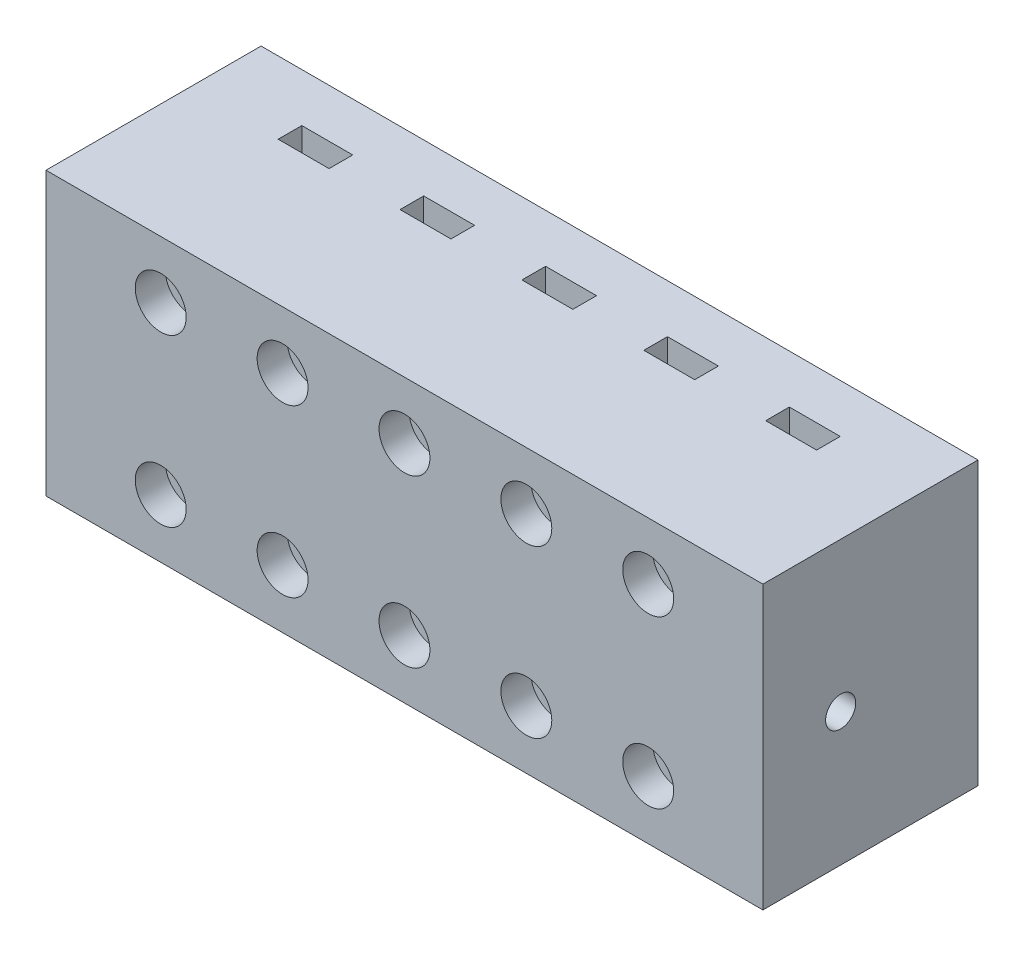
from build123d import *

# Parameters (mm, degrees)
SKIZZE2_W                            = 100
SKIZZE2_H                            = 39.364160046
AUFSATZ_LINEAR_AUSTRAGEN1_DEPTH      = 30
SCHNITT_LINEAR_AUSTRAGEN1_DEPTH      = 40
SCHNITT_LINEAR_AUSTRAGEN1_DEPTH_BACK = 40
SKIZZE10_R                           = 5
SKIZZE17_R                           = 1.55
SCHNITT_LINEAR_AUSTRAGEN2_DEPTH      = 9.1
SKIZZE24_R                           = 2.05
SCHNITT_LINEAR_AUSTRAGEN4_DEPTH      = 112.577493681
SKIZZE41_R                           = 3.55
SCHNITT_LINEAR_AUSTRAGEN11_DEPTH     = 4.2
LINEARES_MUSTER5_COUNT               = 5
LINEARES_MUSTER5_PITCH               = 17
SPIEGELN9_COPY_1_SKETCH_R            = 3.55
SPIEGELN9_COPY_1_DEPTH               = 4.2
SPIEGELN9_COPY_2_SKETCH_R            = 3.55
SPIEGELN9_COPY_2_DEPTH               = 4.2
SPIEGELN9_COPY_3_SKETCH_R            = 3.55
SPIEGELN9_COPY_3_DEPTH               = 4.2
SPIEGELN9_COPY_4_SKETCH_R            = 3.55
SPIEGELN9_COPY_4_DEPTH               = 4.2
SPIEGELN9_COPY_5_SKETCH_R            = 3.55
SPIEGELN9_COPY_5_DEPTH               = 4.2
SKIZZE28_W                           = 7.1
SKIZZE28_H                           = 3.3
SCHNITT_LINEAR_AUSTRAGEN5_DEPTH      = 7.96
SCHNITT_LINEAR_START                 = -4.2
SCHNITT_LINEAR_AUSTRAGEN8_DEPTH      = 5.85
LINEARES_MUSTER3_COUNT               = 5
LINEARES_MUSTER3_PITCH               = 17
LINEARES_MUSTER4_COUNT               = 5
LINEARES_MUSTER4_PITCH               = 17
SPIEGELN7_START                      = -4.2
SPIEGELN7_COPY_1_DEPTH               = 5.85
SPIEGELN7_COPY_2_DEPTH               = 5.85
SPIEGELN7_COPY_3_DEPTH               = 5.85
SPIEGELN7_COPY_4_DEPTH               = 5.85
SPIEGELN7_COPY_5_DEPTH               = 5.85
SPIEGELN8_COPY_1_SKETCH_W            = 7.1
SPIEGELN8_COPY_1_SKETCH_H            = 3.3
SPIEGELN8_COPY_1_DEPTH               = 7.96
SPIEGELN8_COPY_2_SKETCH_W            = 7.1
SPIEGELN8_COPY_2_SKETCH_H            = 3.3
SPIEGELN8_COPY_2_DEPTH               = 7.96
SPIEGELN8_COPY_3_SKETCH_W            = 7.1
SPIEGELN8_COPY_3_SKETCH_H            = 3.3
SPIEGELN8_COPY_3_DEPTH               = 7.96
SPIEGELN8_COPY_4_SKETCH_W            = 7.1
SPIEGELN8_COPY_4_SKETCH_H            = 3.3
SPIEGELN8_COPY_4_DEPTH               = 7.96
SPIEGELN8_COPY_5_SKETCH_W            = 7.1
SPIEGELN8_COPY_5_SKETCH_H            = 3.3
SPIEGELN8_COPY_5_DEPTH               = 7.96
SKIZZE37_R                           = 0.5
SCHNITT_LINEAR_AUSTRAGEN9_DEPTH      = 112.577493681
SKIZZE40_R                           = 2.1
SCHNITT_LINEAR_AUSTRAGEN10_DEPTH     = 6


with BuildPart() as part:
    # Skizze2 → Aufsatz-Linear austragen1 (new body)
    with BuildSketch(Plane.XY):
        with Locations((50, 19.682080023)):
            Rectangle(SKIZZE2_W, SKIZZE2_H)
    extrude(amount=AUFSATZ_LINEAR_AUSTRAGEN1_DEPTH)

    # Skizze10 → Schnitt-Linear austragen1 (cut, two sides: drawn at the far end of the back side and taken through both)
    with BuildSketch(Plane.ZY.offset(-50).offset(-SCHNITT_LINEAR_AUSTRAGEN1_DEPTH_BACK)):
        with Locations((14.945770016, 20.027045739)):
            Circle(SKIZZE10_R)
    extrude(amount=SCHNITT_LINEAR_AUSTRAGEN1_DEPTH + SCHNITT_LINEAR_AUSTRAGEN1_DEPTH_BACK, mode=Mode.SUBTRACT)

    # Skizze17 → Schnitt-Linear austragen2 (cut)
    with BuildSketch(Plane.ZY.offset(-90)):
        with Locations((14.945770016, 20.027045739)):
            Circle(SKIZZE17_R)
    schnitt_linear_austragen2 = extrude(amount=-SCHNITT_LINEAR_AUSTRAGEN2_DEPTH, mode=Mode.SUBTRACT)

    # Spiegeln1: Schnitt-Linear austragen2 across plane
    add(schnitt_linear_austragen2.mirror(Plane.ZY.offset(-50)), mode=Mode.SUBTRACT)

    # Skizze24 → Schnitt-Linear austragen4 (cut, through all)
    with BuildSketch(Plane.XY.offset(30)):
        with Locations((16, 31.364160046)):
            Circle(SKIZZE24_R)
        with Locations((33, 31.364160046)):
            Circle(SKIZZE24_R)
        with Locations((50, 31.364160046)):
            Circle(SKIZZE24_R)
        with Locations((67, 31.364160046)):
            Circle(SKIZZE24_R)
        with Locations((84, 31.364160046)):
            Circle(SKIZZE24_R)
    schnitt_linear_austragen4 = extrude(amount=-SCHNITT_LINEAR_AUSTRAGEN4_DEPTH, mode=Mode.SUBTRACT)

    # Spiegeln4: Schnitt-Linear austragen4 across plane
    add(schnitt_linear_austragen4.mirror(Plane.ZX.offset(19.764160046)), mode=Mode.SUBTRACT)

    # Skizze41 → Schnitt-Linear austragen11 (cut)
    with BuildSketch(Plane.XY.offset(30)):
        with Locations((16, 31.364160046)):
            Circle(SKIZZE41_R)
    schnitt_linear_austragen11 = extrude(amount=-SCHNITT_LINEAR_AUSTRAGEN11_DEPTH, mode=Mode.SUBTRACT)

    # Lineares Muster5: Schnitt-Linear austragen11 ×5
    with Locations(*[(i * LINEARES_MUSTER5_PITCH, 0, 0) for i in range(1, LINEARES_MUSTER5_COUNT)]):
        add(schnitt_linear_austragen11, mode=Mode.SUBTRACT)

    # Spiegeln9 copy 1 sketch → Spiegeln9 copy 1 (cut)
    with BuildSketch(Plane(origin=(17, 39.528320093, 30), x_dir=(1, 0, 0), z_dir=(0, 0, 1))):
        with Locations((16, -31.364160046)):
            Circle(SPIEGELN9_COPY_1_SKETCH_R)
    extrude(amount=-SPIEGELN9_COPY_1_DEPTH, mode=Mode.SUBTRACT)

    # Spiegeln9 copy 2 sketch → Spiegeln9 copy 2 (cut)
    with BuildSketch(Plane(origin=(34, 39.528320093, 30), x_dir=(1, 0, 0), z_dir=(0, 0, 1))):
        with Locations((16, -31.364160046)):
            Circle(SPIEGELN9_COPY_2_SKETCH_R)
    extrude(amount=-SPIEGELN9_COPY_2_DEPTH, mode=Mode.SUBTRACT)

    # Spiegeln9 copy 3 sketch → Spiegeln9 copy 3 (cut)
    with BuildSketch(Plane(origin=(51, 39.528320093, 30), x_dir=(1, 0, 0), z_dir=(0, 0, 1))):
        with Locations((16, -31.364160046)):
            Circle(SPIEGELN9_COPY_3_SKETCH_R)
    extrude(amount=-SPIEGELN9_COPY_3_DEPTH, mode=Mode.SUBTRACT)

    # Spiegeln9 copy 4 sketch → Spiegeln9 copy 4 (cut)
    with BuildSketch(Plane(origin=(68, 39.528320093, 30), x_dir=(1, 0, 0), z_dir=(0, 0, 1))):
        with Locations((16, -31.364160046)):
            Circle(SPIEGELN9_COPY_4_SKETCH_R)
    extrude(amount=-SPIEGELN9_COPY_4_DEPTH, mode=Mode.SUBTRACT)

    # Spiegeln9 copy 5 sketch → Spiegeln9 copy 5 (cut)
    with BuildSketch(Plane(origin=(0, 39.528320093, 30), x_dir=(1, 0, 0), z_dir=(0, 0, 1))):
        with Locations((16, -31.364160046)):
            Circle(SPIEGELN9_COPY_5_SKETCH_R)
    extrude(amount=-SPIEGELN9_COPY_5_DEPTH, mode=Mode.SUBTRACT)

    # Skizze28 → Schnitt-Linear austragen5 (cut)
    with BuildSketch(Plane(origin=(0, 0, 0), x_dir=(-1, 0, 0), z_dir=(0, -1, 0))):
        with Locations((-16, -8.415336397)):
            Rectangle(SKIZZE28_W, SKIZZE28_H)
    schnitt_linear_austragen5 = extrude(amount=-SCHNITT_LINEAR_AUSTRAGEN5_DEPTH, mode=Mode.SUBTRACT)

    # Skizze34 → Schnitt-Linear austragen8 (cut)
    with BuildSketch(Plane(origin=(0, 0, 8.4), x_dir=(-1, 0, 0), z_dir=(0, 0, -1)).offset(SCHNITT_LINEAR_START)):
        Polygon((-16, 12.205611931), (-19.5, 10.184885989), (-19.5, 6.143434104), (-16, 4.122708162), (-12.5, 6.143434104), (-12.5, 10.184885989), align=None)
    schnitt_linear_austragen8 = extrude(amount=SCHNITT_LINEAR_AUSTRAGEN8_DEPTH, mode=Mode.SUBTRACT)

    # Lineares Muster3: Schnitt-Linear austragen8 ×5
    with Locations(*[(i * LINEARES_MUSTER3_PITCH, 0, 0) for i in range(1, LINEARES_MUSTER3_COUNT)]):
        add(schnitt_linear_austragen8, mode=Mode.SUBTRACT)

    # Lineares Muster4: Schnitt-Linear austragen5 ×5
    with Locations(*[(i * LINEARES_MUSTER4_PITCH, 0, 0) for i in range(1, LINEARES_MUSTER4_COUNT)]):
        add(schnitt_linear_austragen5, mode=Mode.SUBTRACT)

    # Spiegeln6: Schnitt-Linear austragen8 across plane
    add(schnitt_linear_austragen8.mirror(Plane.ZX.offset(19.764160046)), mode=Mode.SUBTRACT)

    # Spiegeln7 copy 1 sketch → Spiegeln7 copy 1 (cut)
    with BuildSketch(Plane(origin=(17, 39.528320093, 8.4), x_dir=(-1, 0, 0), z_dir=(0, 0, -1)).offset(SPIEGELN7_START)):
        Polygon((-16, -12.205611931), (-19.5, -10.184885989), (-19.5, -6.143434104), (-16, -4.122708162), (-12.5, -6.143434104), (-12.5, -10.184885989), align=None)
    extrude(amount=SPIEGELN7_COPY_1_DEPTH, mode=Mode.SUBTRACT)

    # Spiegeln7 copy 2 sketch → Spiegeln7 copy 2 (cut)
    with BuildSketch(Plane(origin=(34, 39.528320093, 8.4), x_dir=(-1, 0, 0), z_dir=(0, 0, -1)).offset(SPIEGELN7_START)):
        Polygon((-16, -12.205611931), (-19.5, -10.184885989), (-19.5, -6.143434104), (-16, -4.122708162), (-12.5, -6.143434104), (-12.5, -10.184885989), align=None)
    extrude(amount=SPIEGELN7_COPY_2_DEPTH, mode=Mode.SUBTRACT)

    # Spiegeln7 copy 3 sketch → Spiegeln7 copy 3 (cut)
    with BuildSketch(Plane(origin=(51, 39.528320093, 8.4), x_dir=(-1, 0, 0), z_dir=(0, 0, -1)).offset(SPIEGELN7_START)):
        Polygon((-16, -12.205611931), (-19.5, -10.184885989), (-19.5, -6.143434104), (-16, -4.122708162), (-12.5, -6.143434104), (-12.5, -10.184885989), align=None)
    extrude(amount=SPIEGELN7_COPY_3_DEPTH, mode=Mode.SUBTRACT)

    # Spiegeln7 copy 4 sketch → Spiegeln7 copy 4 (cut)
    with BuildSketch(Plane(origin=(68, 39.528320093, 8.4), x_dir=(-1, 0, 0), z_dir=(0, 0, -1)).offset(SPIEGELN7_START)):
        Polygon((-16, -12.205611931), (-19.5, -10.184885989), (-19.5, -6.143434104), (-16, -4.122708162), (-12.5, -6.143434104), (-12.5, -10.184885989), align=None)
    extrude(amount=SPIEGELN7_COPY_4_DEPTH, mode=Mode.SUBTRACT)

    # Spiegeln7 copy 5 sketch → Spiegeln7 copy 5 (cut)
    with BuildSketch(Plane(origin=(0, 39.528320093, 8.4), x_dir=(-1, 0, 0), z_dir=(0, 0, -1)).offset(SPIEGELN7_START)):
        Polygon((-16, -12.205611931), (-19.5, -10.184885989), (-19.5, -6.143434104), (-16, -4.122708162), (-12.5, -6.143434104), (-12.5, -10.184885989), align=None)
    extrude(amount=SPIEGELN7_COPY_5_DEPTH, mode=Mode.SUBTRACT)

    # Spiegeln8 copy 1 sketch → Spiegeln8 copy 1 (cut)
    with BuildSketch(Plane(origin=(17, 39.528320093, 0), x_dir=(-1, 0, 0), z_dir=(0, 1, 0))):
        with Locations((-16, 8.415336397)):
            Rectangle(SPIEGELN8_COPY_1_SKETCH_W, SPIEGELN8_COPY_1_SKETCH_H)
    extrude(amount=-SPIEGELN8_COPY_1_DEPTH, mode=Mode.SUBTRACT)

    # Spiegeln8 copy 2 sketch → Spiegeln8 copy 2 (cut)
    with BuildSketch(Plane(origin=(34, 39.528320093, 0), x_dir=(-1, 0, 0), z_dir=(0, 1, 0))):
        with Locations((-16, 8.415336397)):
            Rectangle(SPIEGELN8_COPY_2_SKETCH_W, SPIEGELN8_COPY_2_SKETCH_H)
    extrude(amount=-SPIEGELN8_COPY_2_DEPTH, mode=Mode.SUBTRACT)

    # Spiegeln8 copy 3 sketch → Spiegeln8 copy 3 (cut)
    with BuildSketch(Plane(origin=(51, 39.528320093, 0), x_dir=(-1, 0, 0), z_dir=(0, 1, 0))):
        with Locations((-16, 8.415336397)):
            Rectangle(SPIEGELN8_COPY_3_SKETCH_W, SPIEGELN8_COPY_3_SKETCH_H)
    extrude(amount=-SPIEGELN8_COPY_3_DEPTH, mode=Mode.SUBTRACT)

    # Spiegeln8 copy 4 sketch → Spiegeln8 copy 4 (cut)
    with BuildSketch(Plane(origin=(68, 39.528320093, 0), x_dir=(-1, 0, 0), z_dir=(0, 1, 0))):
        with Locations((-16, 8.415336397)):
            Rectangle(SPIEGELN8_COPY_4_SKETCH_W, SPIEGELN8_COPY_4_SKETCH_H)
    extrude(amount=-SPIEGELN8_COPY_4_DEPTH, mode=Mode.SUBTRACT)

    # Spiegeln8 copy 5 sketch → Spiegeln8 copy 5 (cut)
    with BuildSketch(Plane(origin=(0, 39.528320093, 0), x_dir=(-1, 0, 0), z_dir=(0, 1, 0))):
        with Locations((-16, 8.415336397)):
            Rectangle(SPIEGELN8_COPY_5_SKETCH_W, SPIEGELN8_COPY_5_SKETCH_H)
    extrude(amount=-SPIEGELN8_COPY_5_DEPTH, mode=Mode.SUBTRACT)

    # Skizze37 → Schnitt-Linear austragen9 (cut, through all)
    with BuildSketch(Plane(origin=(100, 0, 0), x_dir=(0, 0, -1), z_dir=(1, 0, 0))):
        with Locations((-19.158756707, 18.550923217)):
            Circle(SKIZZE37_R)
    extrude(amount=-SCHNITT_LINEAR_AUSTRAGEN9_DEPTH, mode=Mode.SUBTRACT)

    # Skizze40 → Schnitt-Linear austragen10 (cut)
    with BuildSketch(Plane(origin=(100, 0, 0), x_dir=(0, 0, -1), z_dir=(1, 0, 0))):
        with Locations((-19.158756707, 18.550923217)):
            Circle(SKIZZE40_R)
    extrude(amount=-SCHNITT_LINEAR_AUSTRAGEN10_DEPTH, mode=Mode.SUBTRACT)


solid = part.part
